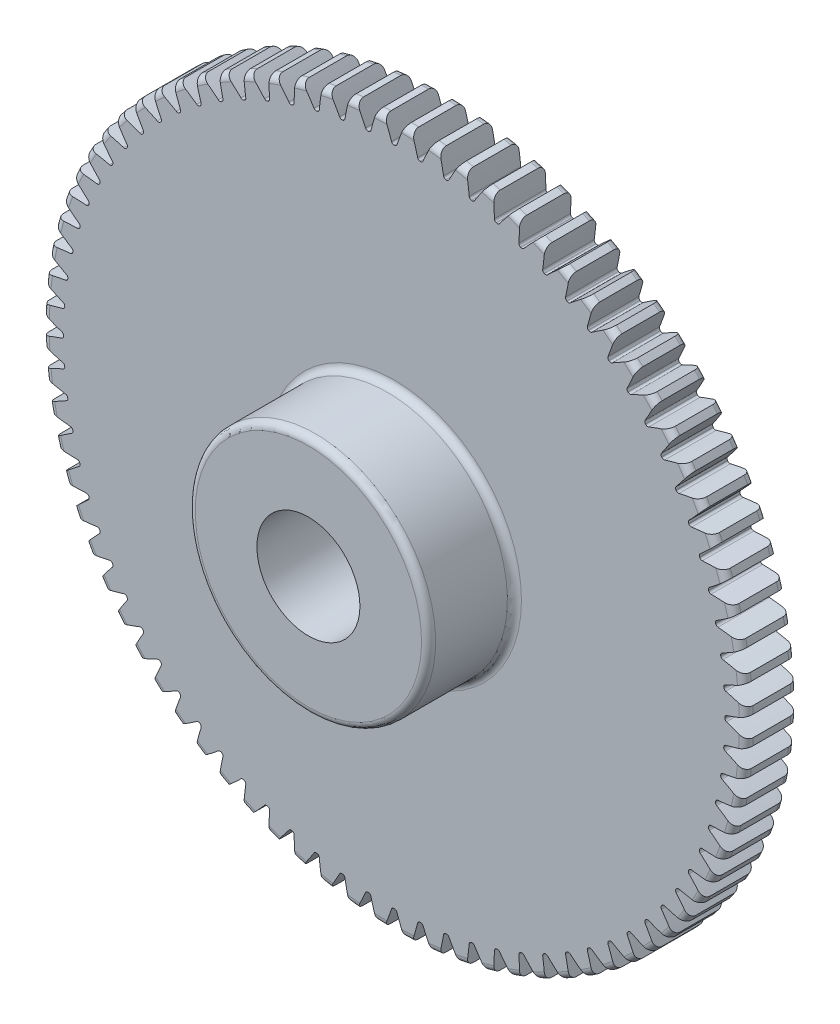
from build123d import *

# Parameters (mm, degrees)
FILLET2_R          = 0.41
CUT_EXTRUDE2_DEPTH = 30.419381436
CIRPATTERN1_COUNT  = 80


with BuildPart() as part:
    # Sketch4 → Revolve1 (revolve)
    with BuildSketch(Plane(origin=(0, 0, 0), x_dir=(0, 0, -1), z_dir=(1, 0, 0))):
        Polygon((-8, 3), (-8, 7), (-3, 7), (-3, 20.5), (0, 20.5), (0, 3), align=None)
    revolve(axis=Axis((0, 0, 3), (0, 0, 1)))

    # Fillet2
    fillet2_edges = [part.edges().sort_by_distance(p)[0] for p in [
        (0, -7, 8),
        (0, -7, 3),
        (0, -20.5, 3),
        (0, -20.5, 0),
    ]]
    fillet(fillet2_edges, radius=FILLET2_R)

    # Sketch7 → Cut-Extrude2 (cut, through all)
    with BuildSketch(Plane.XY.offset(3)):
        with BuildLine():
            ThreePointArc((-0.014173591, 19.249994782), (0, 19.25), (0.014173591, 19.249994782))
            ThreePointArc((0.014173591, 19.249994782), (0.101184846, 19.277729226), (0.155988951, 19.350781728))
            ThreePointArc((0.155988951, 19.350781728), (0.365129565, 19.924446404), (0.591684619, 20.491459424))
            ThreePointArc((0.591684619, 20.491459424), (0, 20.5), (-0.591684619, 20.491459424))
            ThreePointArc((-0.591684619, 20.491459424), (-0.365129565, 19.924446404), (-0.155988951, 19.350781728))
            ThreePointArc((-0.155988951, 19.350781728), (-0.101184846, 19.277729226), (-0.014173591, 19.249994782))
        make_face()
    cut_extrude2 = extrude(amount=-CUT_EXTRUDE2_DEPTH, mode=Mode.SUBTRACT)

    # CirPattern1: Cut-Extrude2 ×80 about axis
    cirpattern1_axis = Axis((0, 0, 8), (0, 0, -1))
    for i in range(1, CIRPATTERN1_COUNT):
        add(cut_extrude2.rotate(cirpattern1_axis, i * 360 / CIRPATTERN1_COUNT), mode=Mode.SUBTRACT)


solid = part.part
